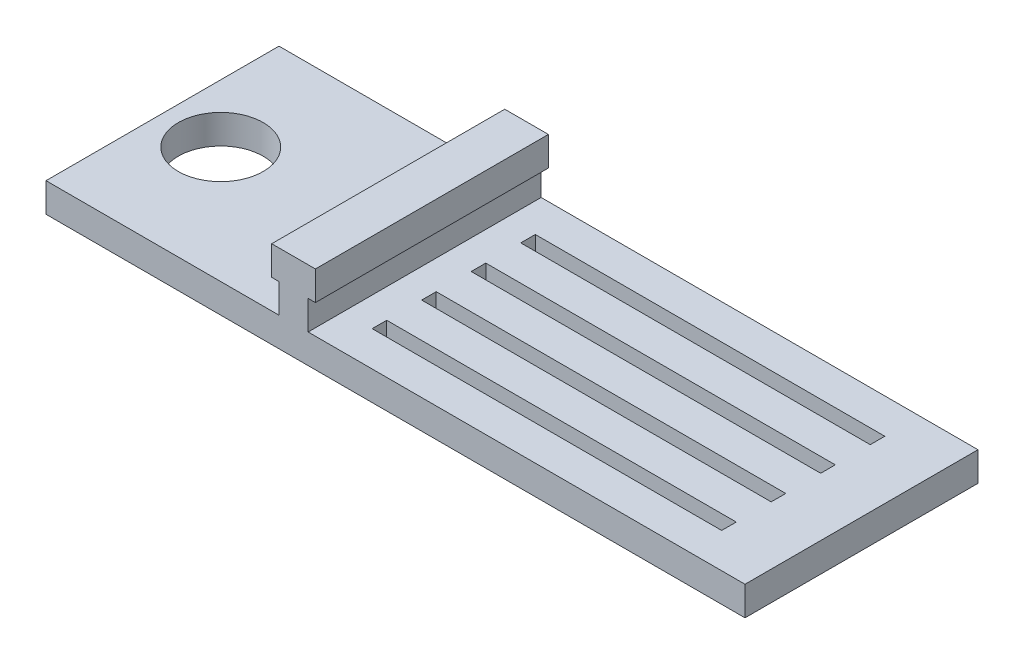
from build123d import *

# Parameters (mm, degrees)
SKETCH1_W           = 304.8
SKETCH1_H           = 101.6
BOSS_EXTRUDE1_DEPTH = 12.7
SKETCH2_W           = 152.4
SKETCH2_H           = 6.35
SKETCH2_H_2         = 6.369922087
CUT_EXTRUDE1_DEPTH  = 322.53831809
SKETCH3_R           = 18.499963
CUT_EXTRUDE2_DEPTH  = 322.53831809
BOSS_EXTRUDE2_DEPTH = 101.6


with BuildPart() as part:
    # Sketch1 → Boss-Extrude1 (new body)
    with BuildSketch(Plane(origin=(0, 0, 0), x_dir=(1, 0, 0), z_dir=(0, 1, 0))):
        with Locations((152.4, 50.8)):
            Rectangle(SKETCH1_W, SKETCH1_H)
    extrude(amount=BOSS_EXTRUDE1_DEPTH)

    # Sketch2 → Cut-Extrude1 (cut, through all)
    with BuildSketch(Plane(origin=(0, 12.7, 0), x_dir=(1, 0, 0), z_dir=(0, 1, 0))):
        with Locations((203.2, 18.395077913)):
            Rectangle(SKETCH2_W, SKETCH2_H)
        with Locations((203.2, 39.985077913)):
            Rectangle(SKETCH2_W, SKETCH2_H)
        with Locations((203.2, 61.585038957)):
            Rectangle(SKETCH2_W, SKETCH2_H_2)
        with Locations((203.2, 83.185)):
            Rectangle(SKETCH2_W, SKETCH2_H)
    extrude(amount=-CUT_EXTRUDE1_DEPTH, mode=Mode.SUBTRACT)

    # Sketch3 → Cut-Extrude2 (cut, through all)
    with BuildSketch(Plane(origin=(0, 12.7, 0), x_dir=(1, 0, 0), z_dir=(0, 1, 0))):
        with Locations((25.4, 50.8)):
            Circle(SKETCH3_R)
    extrude(amount=-CUT_EXTRUDE2_DEPTH, mode=Mode.SUBTRACT)

    # Sketch6 → Boss-Extrude2 (add)
    with BuildSketch(Plane.XY):
        Polygon((101.6, 12.7), (101.6, 25.4), (98.425, 25.4), (98.425, 38.1), (117.475, 38.1), (117.475, 25.4), (114.3, 25.4), (114.3, 12.7), align=None)
    extrude(amount=-BOSS_EXTRUDE2_DEPTH)


solid = part.part
